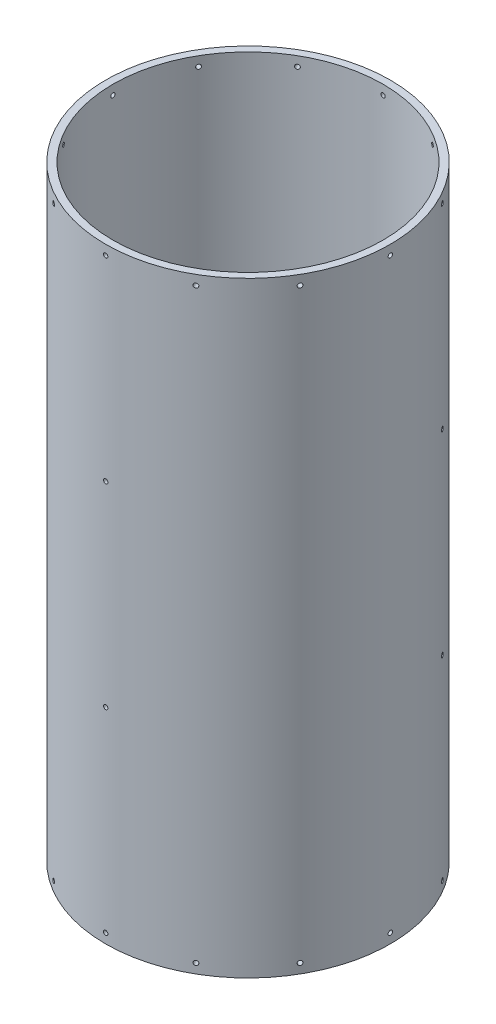
from build123d import *

# Parameters (mm, degrees)
SKETCH1_R                = 93.6625
SKETCH1_R_2              = 88.9
BOSS_EXTRUDE1_DEPTH      = 199.39
SKETCH3_R                = 1.4351
CUT_EXTRUDE1_DEPTH       = 19.304
CIRPATTERN1_COUNT        = 12
MIRROR1_COPY_1_SKETCH_R  = 1.4351
MIRROR1_COPY_1_DEPTH     = 19.304
MIRROR1_COPY_2_SKETCH_R  = 1.4351
MIRROR1_COPY_2_DEPTH     = 19.304
MIRROR1_COPY_3_SKETCH_R  = 1.4351
MIRROR1_COPY_3_DEPTH     = 19.304
MIRROR1_COPY_4_SKETCH_R  = 1.4351
MIRROR1_COPY_4_DEPTH     = 19.304
MIRROR1_COPY_5_SKETCH_R  = 1.4351
MIRROR1_COPY_5_DEPTH     = 19.304
MIRROR1_COPY_6_SKETCH_R  = 1.4351
MIRROR1_COPY_6_DEPTH     = 19.304
MIRROR1_COPY_7_SKETCH_R  = 1.4351
MIRROR1_COPY_7_DEPTH     = 19.304
MIRROR1_COPY_8_SKETCH_R  = 1.4351
MIRROR1_COPY_8_DEPTH     = 19.304
MIRROR1_COPY_9_SKETCH_R  = 1.4351
MIRROR1_COPY_9_DEPTH     = 19.304
MIRROR1_COPY_10_SKETCH_R = 1.4351
MIRROR1_COPY_10_DEPTH    = 19.304
MIRROR1_COPY_11_SKETCH_R = 1.4351
MIRROR1_COPY_11_DEPTH    = 19.304
SKETCH4_R                = 1.4351
CUT_EXTRUDE2_DEPTH       = 43.18
CIRPATTERN2_COUNT        = 3


with BuildPart() as part:
    # Sketch1 → Boss-Extrude1 (new, symmetric)
    with BuildSketch(Plane(origin=(0, 0, 0), x_dir=(1, 0, 0), z_dir=(0, 1, 0))):
        Circle(SKETCH1_R)
        Circle(SKETCH1_R_2, mode=Mode.SUBTRACT)
    extrude(amount=BOSS_EXTRUDE1_DEPTH, both=True)

    # Sketch3 → Cut-Extrude1 (cut)
    with BuildSketch(Plane.XY.offset(93.6625)):
        with Locations((0, -193.04)):
            Circle(SKETCH3_R)
    cut_extrude1 = extrude(amount=-CUT_EXTRUDE1_DEPTH, mode=Mode.SUBTRACT)

    # CirPattern1: Cut-Extrude1 ×12 about axis
    cirpattern1_axis = Axis((0, 199.39, 0), (0, -1, 0))
    for i in range(1, CIRPATTERN1_COUNT):
        add(cut_extrude1.rotate(cirpattern1_axis, i * 360 / CIRPATTERN1_COUNT), mode=Mode.SUBTRACT)

    # Mirror1: Cut-Extrude1 across plane
    add(cut_extrude1.mirror(Plane.ZX), mode=Mode.SUBTRACT)

    # Mirror1 copy 1 sketch → Mirror1 copy 1 (cut)
    with BuildSketch(Plane(origin=(-46.83125, 0, 81.114104382), x_dir=(0.8660254037844387, 0, 0.49999999999999994), z_dir=(-0.49999999999999994, 0, 0.8660254037844387))):
        with Locations((0, 193.04)):
            Circle(MIRROR1_COPY_1_SKETCH_R)
    extrude(amount=-MIRROR1_COPY_1_DEPTH, mode=Mode.SUBTRACT)

    # Mirror1 copy 2 sketch → Mirror1 copy 2 (cut)
    with BuildSketch(Plane(origin=(-81.114104382, 0, 46.83125), x_dir=(0.5000000000000001, 0, 0.8660254037844386), z_dir=(-0.8660254037844386, 0, 0.5000000000000001))):
        with Locations((0, 193.04)):
            Circle(MIRROR1_COPY_2_SKETCH_R)
    extrude(amount=-MIRROR1_COPY_2_DEPTH, mode=Mode.SUBTRACT)

    # Mirror1 copy 3 sketch → Mirror1 copy 3 (cut)
    with BuildSketch(Plane.ZY.offset(93.6625)):
        with Locations((0, 193.04)):
            Circle(MIRROR1_COPY_3_SKETCH_R)
    extrude(amount=-MIRROR1_COPY_3_DEPTH, mode=Mode.SUBTRACT)

    # Mirror1 copy 4 sketch → Mirror1 copy 4 (cut)
    with BuildSketch(Plane(origin=(-81.114104382, 0, -46.83125), x_dir=(-0.4999999999999998, 0, 0.8660254037844387), z_dir=(-0.8660254037844387, 0, -0.4999999999999998))):
        with Locations((0, 193.04)):
            Circle(MIRROR1_COPY_4_SKETCH_R)
    extrude(amount=-MIRROR1_COPY_4_DEPTH, mode=Mode.SUBTRACT)

    # Mirror1 copy 5 sketch → Mirror1 copy 5 (cut)
    with BuildSketch(Plane(origin=(-46.83125, 0, -81.114104382), x_dir=(-0.8660254037844387, 0, 0.49999999999999994), z_dir=(-0.49999999999999994, 0, -0.8660254037844387))):
        with Locations((0, 193.04)):
            Circle(MIRROR1_COPY_5_SKETCH_R)
    extrude(amount=-MIRROR1_COPY_5_DEPTH, mode=Mode.SUBTRACT)

    # Mirror1 copy 6 sketch → Mirror1 copy 6 (cut)
    with BuildSketch(Plane(origin=(0, 0, -93.6625), x_dir=(-1, 0, 0), z_dir=(0, 0, -1))):
        with Locations((0, 193.04)):
            Circle(MIRROR1_COPY_6_SKETCH_R)
    extrude(amount=-MIRROR1_COPY_6_DEPTH, mode=Mode.SUBTRACT)

    # Mirror1 copy 7 sketch → Mirror1 copy 7 (cut)
    with BuildSketch(Plane(origin=(46.83125, 0, -81.114104382), x_dir=(-0.8660254037844386, 0, -0.5000000000000001), z_dir=(0.5000000000000001, 0, -0.8660254037844386))):
        with Locations((0, 193.04)):
            Circle(MIRROR1_COPY_7_SKETCH_R)
    extrude(amount=-MIRROR1_COPY_7_DEPTH, mode=Mode.SUBTRACT)

    # Mirror1 copy 8 sketch → Mirror1 copy 8 (cut)
    with BuildSketch(Plane(origin=(81.114104382, 0, -46.83125), x_dir=(-0.5000000000000004, 0, -0.8660254037844384), z_dir=(0.8660254037844384, 0, -0.5000000000000004))):
        with Locations((0, 193.04)):
            Circle(MIRROR1_COPY_8_SKETCH_R)
    extrude(amount=-MIRROR1_COPY_8_DEPTH, mode=Mode.SUBTRACT)

    # Mirror1 copy 9 sketch → Mirror1 copy 9 (cut)
    with BuildSketch(Plane(origin=(93.6625, 0, 0), x_dir=(0, 0, -1), z_dir=(1, 0, 0))):
        with Locations((0, 193.04)):
            Circle(MIRROR1_COPY_9_SKETCH_R)
    extrude(amount=-MIRROR1_COPY_9_DEPTH, mode=Mode.SUBTRACT)

    # Mirror1 copy 10 sketch → Mirror1 copy 10 (cut)
    with BuildSketch(Plane(origin=(81.114104382, 0, 46.83125), x_dir=(0.5000000000000001, 0, -0.8660254037844386), z_dir=(0.8660254037844386, 0, 0.5000000000000001))):
        with Locations((0, 193.04)):
            Circle(MIRROR1_COPY_10_SKETCH_R)
    extrude(amount=-MIRROR1_COPY_10_DEPTH, mode=Mode.SUBTRACT)

    # Mirror1 copy 11 sketch → Mirror1 copy 11 (cut)
    with BuildSketch(Plane(origin=(46.83125, 0, 81.114104382), x_dir=(0.8660254037844384, 0, -0.5000000000000004), z_dir=(0.5000000000000004, 0, 0.8660254037844384))):
        with Locations((0, 193.04)):
            Circle(MIRROR1_COPY_11_SKETCH_R)
    extrude(amount=-MIRROR1_COPY_11_DEPTH, mode=Mode.SUBTRACT)

    # Sketch4 → Cut-Extrude2 (cut)
    with BuildSketch(Plane.XY.offset(93.6625)):
        with Locations((0, 64.3636)):
            Circle(SKETCH4_R)
        with Locations((0, -64.3636)):
            Circle(SKETCH4_R)
    cut_extrude2 = extrude(amount=-CUT_EXTRUDE2_DEPTH, mode=Mode.SUBTRACT)

    # CirPattern2: Cut-Extrude2 ×3 about axis
    cirpattern2_axis = Axis((0, 199.39, 0), (0, -1, 0))
    for i in range(1, CIRPATTERN2_COUNT):
        add(cut_extrude2.rotate(cirpattern2_axis, i * 360 / CIRPATTERN2_COUNT), mode=Mode.SUBTRACT)


solid = part.part
